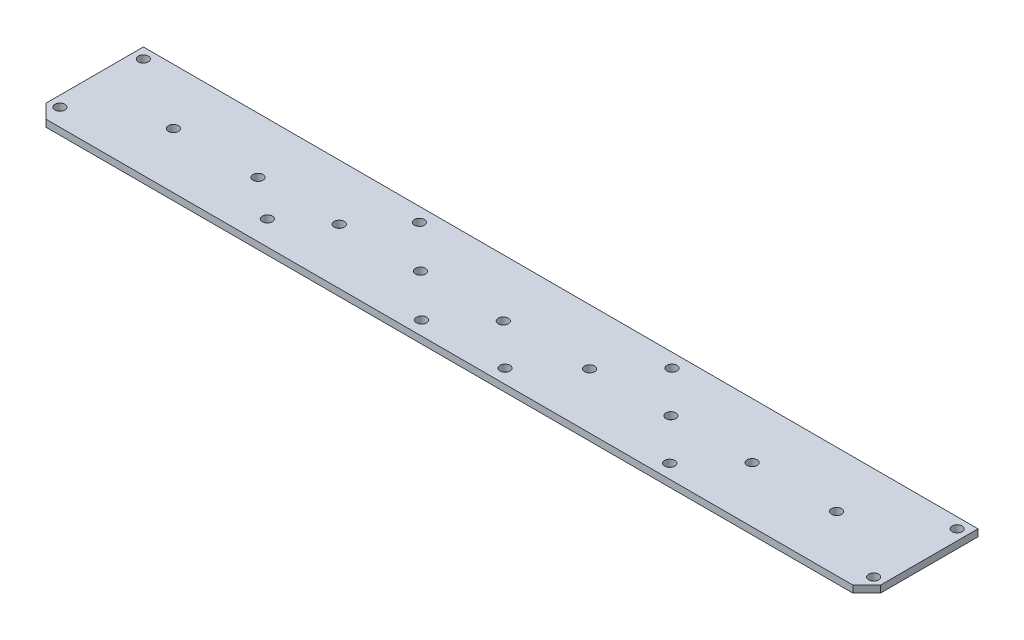
from build123d import *

# Parameters (mm, degrees)
SKETCH2_W           = 381
SKETCH2_H           = 50.8
BOSS_EXTRUDE1_DEPTH = 3.175
SKETCH3_R           = 2.286
CUT_EXTRUDE1_DEPTH  = 385.384860036


with BuildPart() as part:
    # Sketch2 → Boss-Extrude1 (new body)
    with BuildSketch(Plane(origin=(0, 0, 0), x_dir=(1, 0, 0), z_dir=(0, 1, 0))):
        with Locations((190.5, 25.4)):
            Rectangle(SKETCH2_W, SKETCH2_H)
    extrude(amount=BOSS_EXTRUDE1_DEPTH)

    # Sketch3 → Cut-Extrude1 (cut, through all)
    with BuildSketch(Plane(origin=(0, 0, 0), x_dir=(1, 0, 0), z_dir=(0, 1, 0))):
        with Locations((96.266, 11.1125)):
            Circle(SKETCH3_R)
        with Locations((284.734, 6.35)):
            Circle(SKETCH3_R)
        with Locations((132.334, 44.45)):
            Circle(SKETCH3_R)
        with Locations((247.65, 44.45)):
            Circle(SKETCH3_R)
        with Locations((209.55, 6.35)):
            Circle(SKETCH3_R)
        with Locations((171.45, 6.35)):
            Circle(SKETCH3_R)
        with Locations((4.7625, 7.9375)):
            Circle(SKETCH3_R)
        with Locations((4.7625, 46.0375)):
            Circle(SKETCH3_R)
        with Locations((39.116, 25.4)):
            Circle(SKETCH3_R)
        with Locations((77.724, 25.4)):
            Circle(SKETCH3_R)
        with Locations((114.808, 25.4)):
            Circle(SKETCH3_R)
        with Locations((190.5, 24.60625)):
            Circle(SKETCH3_R)
        with Locations((341.884, 25.4)):
            Circle(SKETCH3_R)
        with Locations((376.2375, 7.9375)):
            Circle(SKETCH3_R)
        with Locations((376.2375, 46.0375)):
            Circle(SKETCH3_R)
        with Locations((303.276, 25.4)):
            Circle(SKETCH3_R)
        with Locations((266.192, 25.4)):
            Circle(SKETCH3_R)
        with Locations((229.108, 25.4)):
            Circle(SKETCH3_R)
        with Locations((151.892, 25.4)):
            Circle(SKETCH3_R)
        Polygon((0, 6.35), (6.35, 0), (0, 0), align=None)
        Polygon((374.65, 0), (381, 6.35), (381, 0), align=None)
    extrude(amount=CUT_EXTRUDE1_DEPTH, mode=Mode.SUBTRACT)


solid = part.part
